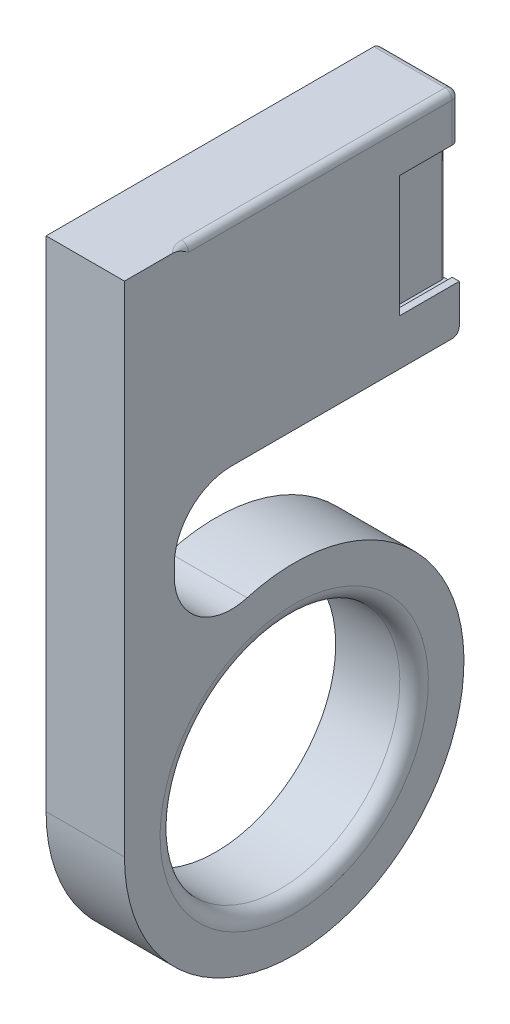
from build123d import *

# Parameters (mm, degrees)
SKETCH1_R           = 23.8275
SKETCH1_R_2         = 16.8275
BOSS_EXTRUDE1_DEPTH = 25
SKETCH2_W           = 25
SKETCH2_H           = 7
BOSS_EXTRUDE2_DEPTH = 70
SKETCH3_W           = 11
SKETCH3_H           = 30
BOSS_EXTRUDE3_DEPTH = 40
SKETCH4_W           = 8.4
SKETCH4_H           = 17.05
CUT_EXTRUDE1_DEPTH  = 1
SKETCH5_W           = 9
SKETCH5_H           = 18.25
CUT_EXTRUDE2_DEPTH  = 1
FILLET1_R           = 0.5
FILLET2_R           = 1
FILLET4_R           = 2
FILLET6_R           = 1
SKETCH6_W           = 64.351339454
SKETCH6_H           = 103.716123398
CUT_EXTRUDE3_DEPTH  = 76.257888476
FILLET7_R           = 8
FILLET8_R           = 2


with BuildPart() as part:
    # Sketch1 → Boss-Extrude1 (new body)
    with BuildSketch(Plane(origin=(0, 0, 0), x_dir=(0, 0, -1), z_dir=(1, 0, 0))):
        Circle(SKETCH1_R)
        Circle(SKETCH1_R_2, mode=Mode.SUBTRACT)
    extrude(amount=BOSS_EXTRUDE1_DEPTH)

    # Sketch2 → Boss-Extrude2 (add)
    with BuildSketch(Plane(origin=(0, 0, 0), x_dir=(1, 0, 0), z_dir=(0, 1, 0))):
        with Locations((12.5, -20.3275)):
            Rectangle(SKETCH2_W, SKETCH2_H)
    extrude(amount=BOSS_EXTRUDE2_DEPTH)

    # Sketch3 → Boss-Extrude3 (add)
    with BuildSketch(Plane(origin=(0, 0, 16.8275), x_dir=(-1, 0, 0), z_dir=(0, 0, -1))):
        with Locations((-5.5, 55)):
            Rectangle(SKETCH3_W, SKETCH3_H)
    extrude(amount=BOSS_EXTRUDE3_DEPTH)

    # Sketch4 → Cut-Extrude1 (cut)
    with BuildSketch(Plane(origin=(11, 0, 0), x_dir=(0, 0, -1), z_dir=(1, 0, 0))):
        with Locations((18.9725, 55)):
            Rectangle(SKETCH4_W, SKETCH4_H)
    extrude(amount=-CUT_EXTRUDE1_DEPTH, mode=Mode.SUBTRACT)

    # Sketch5 → Cut-Extrude2 (cut)
    with BuildSketch(Plane(origin=(10, 0, 0), x_dir=(0, 0, -1), z_dir=(1, 0, 0))):
        with Locations((18.6725, 55)):
            Rectangle(SKETCH5_W, SKETCH5_H)
    extrude(amount=-CUT_EXTRUDE2_DEPTH, mode=Mode.SUBTRACT)

    # Fillet1
    fillet1_edges = [part.edges().sort_by_distance(p)[0] for p in [
        (9, 55, -23.1725),
    ]]
    fillet(fillet1_edges, radius=FILLET1_R)

    # Fillet2
    fillet2_edges = [part.edges().sort_by_distance(p)[0] for p in [
        (5.5, 40, -23.1725),
        (0, 55, -23.1725),
        (5.5, 70, -23.1725),
    ]]
    fillet(fillet2_edges, radius=FILLET2_R)

    # Fillet4
    fillet4_edges = [part.edges().sort_by_distance(p)[0] for p in [
        (11, 55, 16.8275),
    ]]
    fillet(fillet4_edges, radius=FILLET4_R)

    # Fillet6
    fillet6_edges = [part.edges().sort_by_distance(p)[0] for p in [
        (11, 66.2625, -23.1725),
        (11, 69.707106781, -22.879606781),
        (11, 70, -3.6725),
        (11.585786438, 70, 16.241713562),
        (19, 70, 16.8275),
        (25, 43.43482365, 16.8275),
    ]]
    fillet(fillet6_edges, radius=FILLET6_R)

    # Sketch6 → Cut-Extrude3 (cut, through all)
    with BuildSketch(Plane(origin=(11, 0, 0), x_dir=(0, 0, -1), z_dir=(1, 0, 0))):
        with Locations((-0.166549121, 23.355086062)):
            Rectangle(SKETCH6_W, SKETCH6_H)
    extrude(amount=CUT_EXTRUDE3_DEPTH, mode=Mode.SUBTRACT)

    # Fillet7
    fillet7_edges = [part.edges().sort_by_distance(p)[0] for p in [
        (5.5, 16.869647299, 16.8275),
        (5.5, 40, 16.8275),
    ]]
    fillet(fillet7_edges, radius=FILLET7_R)

    # Fillet8
    fillet8_edges = [part.edges().sort_by_distance(p)[0] for p in [
        (11, 0, 16.8275),
    ]]
    fillet(fillet8_edges, radius=FILLET8_R)


solid = part.part
